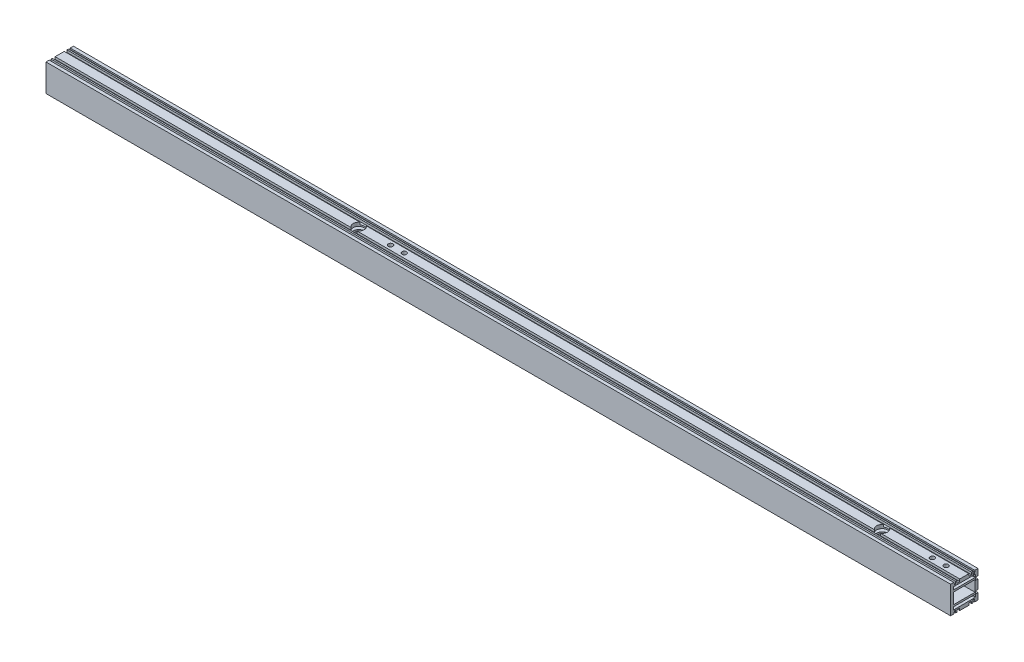
from build123d import *

# Parameters (mm, degrees)
SKETCH_1_W              = 23.5
SKETCH_1_H              = 12
EXTRUDE_1_DEPTH         = 495.5
HOLE_WIZARD_M6_1_D      = 5
HOLE_WIZARD_M6_1_DEPTH  = 19
HOLE_WIZARD_M6_1_TIP    = 1.502151548
HOLE_WIZARD_M6_2_D      = 5
HOLE_WIZARD_M6_2_DEPTH  = 19
HOLE_WIZARD_M6_2_TIP    = 1.502151548
HOLE_WIZARD_M6_3_D      = 5
HOLE_WIZARD_M6_3_DEPTH  = 19
HOLE_WIZARD_M6_3_TIP    = 1.502151548
HOLE_WIZARD_M4_1_D      = 3.3
HOLE_WIZARD_M4_1_DEPTH  = 15
HOLE_WIZARD_M4_1_TIP    = 0.991420021
HOLE_WIZARD_12_0_12_1_D = 12


with BuildPart() as part:
    # 草图1 → 凸台-拉伸1 (new, symmetric)
    with BuildSketch(Plane(origin=(0, 0, 0), x_dir=(0, 0, -1), z_dir=(1, 0, 0))):
        Polygon((-11.5, 15), (-15, 15), (-15, -15), (-11.5, -15), (-11.5, -13.5), (-11, -13.5), (-11, -12), (-9.5, -12), (-9.5, -15), (-8, -15), (-8, -12.5), (-5, -12.5), (-5, -15), (5, -15), (5, -12.5), (8, -12.5), (8, -15), (9.5, -15), (9.5, -12), (11, -12), (11, -13.5), (11.5, -13.5), (11.5, -15), (15, -15), (15, -8), (12.5, -8), (12.5, -5), (15, -5), (15, 5), (12.5, 5), (12.5, 8), (15, 8), (15, 15), (11.5, 15), (11.5, 13.5), (11, 13.5), (11, 12), (9.5, 12), (9.5, 15), (8, 15), (8, 12.5), (5, 12.5), (5, 15), (-5, 15), (-5, 12.5), (-8, 12.5), (-8, 15), (-9.5, 15), (-9.5, 12), (-11, 12), (-11, 13.5), (-11.5, 13.5), align=None)
        with BuildLine():
            Line((12, -8.5), (12, -10.5))
            ThreePointArc((12, -10.5), (11.853553391, -10.853553391), (11.5, -11))
            Line((11.5, -11), (-11.5, -11))
            ThreePointArc((-11.5, -11), (-11.853553391, -10.853553391), (-12, -10.5))
            Line((-12, -10.5), (-12, -8.5))
            ThreePointArc((-12, -8.5), (-11.853553391, -8.146446609), (-11.5, -8))
            Line((-11.5, -8), (11.5, -8))
            ThreePointArc((11.5, -8), (11.853553391, -8.146446609), (12, -8.5))
        make_face(mode=Mode.SUBTRACT)
        Rectangle(SKETCH_1_W, SKETCH_1_H, mode=Mode.SUBTRACT)
        with BuildLine():
            ThreePointArc((-12, 10.5), (-11.853553391, 10.853553391), (-11.5, 11))
            Line((-11.5, 11), (11.5, 11))
            ThreePointArc((11.5, 11), (11.853553391, 10.853553391), (12, 10.5))
            Line((12, 10.5), (12, 8.5))
            ThreePointArc((12, 8.5), (11.853553391, 8.146446609), (11.5, 8))
            Line((11.5, 8), (-11.5, 8))
            ThreePointArc((-11.5, 8), (-11.853553391, 8.146446609), (-12, 8.5))
            Line((-12, 8.5), (-12, 10.5))
        make_face(mode=Mode.SUBTRACT)
    extrude(amount=EXTRUDE_1_DEPTH, both=True)

    # M6 螺纹孔1
    with Locations(Plane(origin=(0, 0, -15), x_dir=(-1, 0, 0), z_dir=(0, 0, -1))):
        with Locations((445.5, 0), (430.5, 0), (370.5, 0), (266.5, 0), (394.5, 0)):
            Hole(HOLE_WIZARD_M6_1_D / 2, depth=HOLE_WIZARD_M6_1_DEPTH)
            with Locations((0, 0, -(HOLE_WIZARD_M6_1_DEPTH + HOLE_WIZARD_M6_1_TIP / 2))):  # 118° drill point
                Cone(0, HOLE_WIZARD_M6_1_D / 2, HOLE_WIZARD_M6_1_TIP, mode=Mode.SUBTRACT)

    # M6 螺纹孔2
    with Locations(Plane(origin=(0, 15, 0), x_dir=(1, 0, 0), z_dir=(0, 1, 0))):
        with Locations((-133, 0), (-118, 0), (460.5, 0), (475.5, 0)):
            Hole(HOLE_WIZARD_M6_2_D / 2, depth=HOLE_WIZARD_M6_2_DEPTH)
            with Locations((0, 0, -(HOLE_WIZARD_M6_2_DEPTH + HOLE_WIZARD_M6_2_TIP / 2))):  # 118° drill point
                Cone(0, HOLE_WIZARD_M6_2_D / 2, HOLE_WIZARD_M6_2_TIP, mode=Mode.SUBTRACT)

    # M6 螺纹孔3
    with Locations(Plane(origin=(0, -15, 0), x_dir=(-1, 0, 0), z_dir=(0, -1, 0))):
        with Locations((445.5, 0), (430.5, 0), (-230.5, 0), (-245.5, 0), (-460.5, 0), (-475.5, 0)):
            Hole(HOLE_WIZARD_M6_3_D / 2, depth=HOLE_WIZARD_M6_3_DEPTH)
            with Locations((0, 0, -(HOLE_WIZARD_M6_3_DEPTH + HOLE_WIZARD_M6_3_TIP / 2))):  # 118° drill point
                Cone(0, HOLE_WIZARD_M6_3_D / 2, HOLE_WIZARD_M6_3_TIP, mode=Mode.SUBTRACT)

    # M4 螺纹孔1
    with Locations(Plane(origin=(0, 0, -15), x_dir=(-1, 0, 0), z_dir=(0, 0, -1))):
        with Locations((191, 0), (236, 0), (341, 0), (296, 0)):
            Hole(HOLE_WIZARD_M4_1_D / 2, depth=HOLE_WIZARD_M4_1_DEPTH)
            with Locations((0, 0, -(HOLE_WIZARD_M4_1_DEPTH + HOLE_WIZARD_M4_1_TIP / 2))):  # 118° drill point
                Cone(0, HOLE_WIZARD_M4_1_D / 2, HOLE_WIZARD_M4_1_TIP, mode=Mode.SUBTRACT)

    # Ø12.0 (12) 直径孔1 (through all)
    with Locations(Plane(origin=(0, -15, 0), x_dir=(-1, 0, 0), z_dir=(0, -1, 0))):
        with Locations((168, 0), (-405.5, 0)):
            Hole(HOLE_WIZARD_12_0_12_1_D / 2)


solid = part.part
